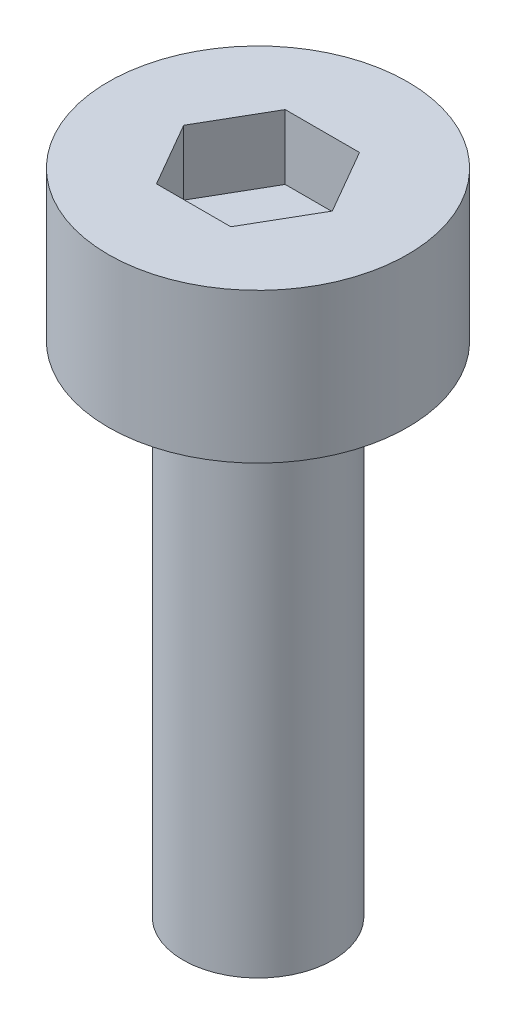
from build123d import *

# Parameters (mm, degrees)
SKETCH1_R           = 1.5
SCREWSHAFT_DEPTH    = 10
SKETCH2_R           = 3
BOSS_EXTRUDE2_DEPTH = 3
CUT_EXTRUDE1_DEPTH  = 1.3


with BuildPart() as part:
    # Sketch1 → ScrewShaft (new body)
    with BuildSketch(Plane(origin=(0, 0, 0), x_dir=(1, 0, 0), z_dir=(0, 1, 0))):
        Circle(SKETCH1_R)
    extrude(amount=SCREWSHAFT_DEPTH)

    # Sketch2 → Boss-Extrude2 (add)
    with BuildSketch(Plane(origin=(0, 10, 0), x_dir=(1, 0, 0), z_dir=(0, 1, 0))):
        Circle(SKETCH2_R)
    extrude(amount=BOSS_EXTRUDE2_DEPTH)

    # Sketch3 → Cut-Extrude1 (cut)
    with BuildSketch(Plane(origin=(0, 13, 0), x_dir=(1, 0, 0), z_dir=(0, 1, 0))):
        Polygon((1.489563695, 0), (0.744781847, 1.29), (-0.744781847, 1.29), (-1.489563695, 0), (-0.744781847, -1.29), (0.744781847, -1.29), align=None)
    extrude(amount=-CUT_EXTRUDE1_DEPTH, mode=Mode.SUBTRACT)


solid = part.part
